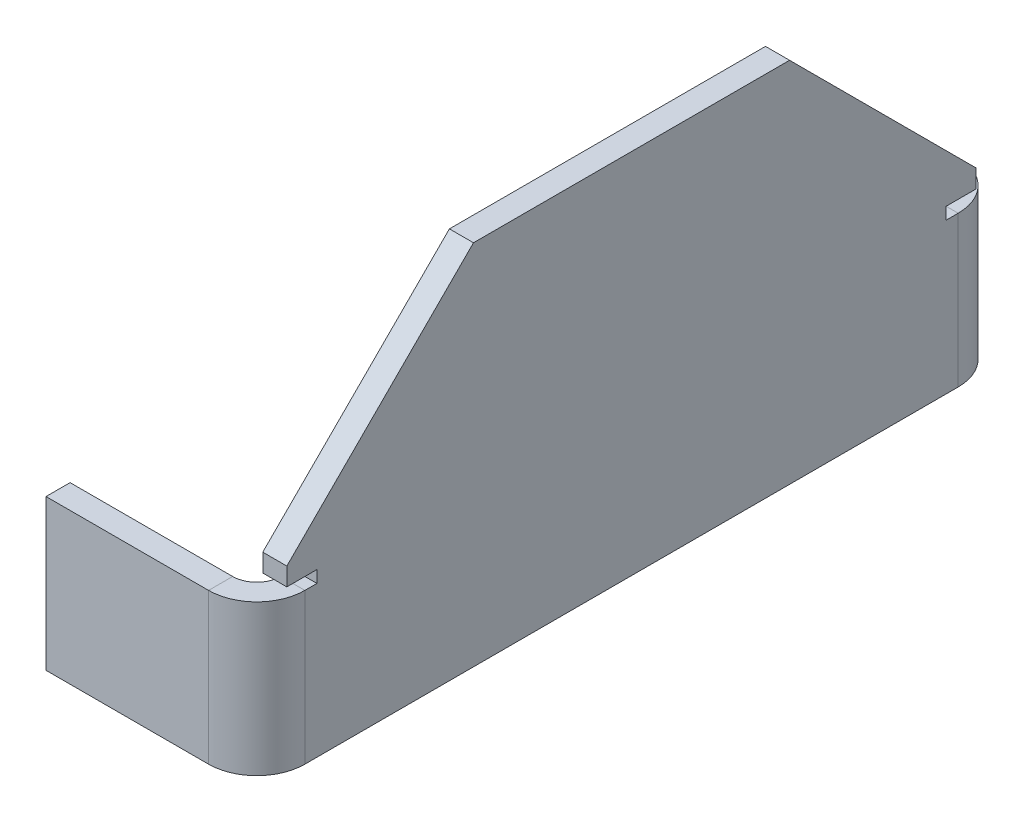
from build123d import *

# Parameters (mm, degrees)
SM_BASE_FLANGE_1_DEPTH              = 8
SM_EDGE_FLANGE_1_STRIP_W            = 48
SM_EDGE_FLANGE_1_STRIP_H            = 8
SM_EDGE_FLANGE_1_STRIP_CUT_DEPTH    = 50
SM_EDGE_FLANGE_1_RELIEF_W           = 52
SM_EDGE_FLANGE_1_RELIEF_H           = 4
SM_EDGE_FLANGE_1_RELIEF_CUT_DEPTH   = 8
SM_EDGE_FLANGE_1_STRIP_2_W          = 48
SM_EDGE_FLANGE_1_STRIP_2_H          = 8
SM_EDGE_FLANGE_1_STRIP_CUT_2_DEPTH  = 50
SM_EDGE_FLANGE_1_RELIEF_2_W         = 52
SM_EDGE_FLANGE_1_RELIEF_2_H         = 4
SM_EDGE_FLANGE_1_RELIEF_CUT_2_DEPTH = 8
SM_EDGE_FLANGE_1_DEPTH              = 50
SM_EDGE_FLANGE_1_BEND_DEPTH         = 50


# Sheet-metal steps are written as plain solids
with BuildPart() as part:
    # Sketch 1 → 基体-法兰1 (new body)
    with BuildSketch(Plane(origin=(0, 0, 0), x_dir=(0, 0, -1), z_dir=(1, 0, 0))):
        Polygon((-52.5, 122), (52.5, 122), (114.5, 60), (114.5, 50), (124.5, 50), (124.5, 0), (-124.5, 0), (-124.5, 50), (-114.5, 50), (-114.5, 60), align=None)
    extrude(amount=-SM_BASE_FLANGE_1_DEPTH)

    # 边线-法兰1 strip (across the edge) → 边线-法兰1 strip cut (cut)
    with BuildSketch(Plane(origin=(-8, 0, 124.5), x_dir=(0, 0, -1), z_dir=(0, 1, 0))):
        with Locations((-8, -4)):
            Rectangle(SM_EDGE_FLANGE_1_STRIP_W, SM_EDGE_FLANGE_1_STRIP_H)
    extrude(amount=SM_EDGE_FLANGE_1_STRIP_CUT_DEPTH, mode=Mode.SUBTRACT)

    # 边线-法兰1 relief (on the sheet) → 边线-法兰1 relief cut (cut)
    with BuildSketch(Plane(origin=(-8, 0, 108.5), x_dir=(0, 0, -1), z_dir=(-1, 0, 0))):
        with Locations((-22, -52)):
            Rectangle(SM_EDGE_FLANGE_1_RELIEF_W, SM_EDGE_FLANGE_1_RELIEF_H)
    extrude(amount=-SM_EDGE_FLANGE_1_RELIEF_CUT_DEPTH, mode=Mode.SUBTRACT)

    # 边线-法兰1 strip 2 (across the edge) → 边线-法兰1 strip cut 2 (cut)
    with BuildSketch(Plane(origin=(-8, 50, -124.5), x_dir=(0, 0, 1), z_dir=(0, -1, 0))):
        with Locations((-8, -4)):
            Rectangle(SM_EDGE_FLANGE_1_STRIP_2_W, SM_EDGE_FLANGE_1_STRIP_2_H)
    extrude(amount=SM_EDGE_FLANGE_1_STRIP_CUT_2_DEPTH, mode=Mode.SUBTRACT)

    # 边线-法兰1 relief 2 (on the sheet) → 边线-法兰1 relief cut 2 (cut)
    with BuildSketch(Plane(origin=(-8, 50, -108.5), x_dir=(0, 0, 1), z_dir=(-1, 0, 0))):
        with Locations((-22, 2)):
            Rectangle(SM_EDGE_FLANGE_1_RELIEF_2_W, SM_EDGE_FLANGE_1_RELIEF_2_H)
    extrude(amount=-SM_EDGE_FLANGE_1_RELIEF_CUT_2_DEPTH, mode=Mode.SUBTRACT)

    # 边线-法兰1 section (across the edge) → 边线-法兰1 (add)
    with BuildSketch(Plane(origin=(-8, 0, 124.5), x_dir=(0, 0, -1), z_dir=(0, 1, 0))):
        with BuildLine():
            Line((0, 8), (0, 62))
            Line((0, 62), (8, 62))
            Line((8, 62), (8, 8))
            ThreePointArc((8, 8), (10.343145751, 2.343145751), (16, 0))
            Line((16, 0), (16, -8))
            ThreePointArc((16, -8), (4.686291501, -3.313708499), (0, 8))
        make_face()
    extrude(amount=SM_EDGE_FLANGE_1_DEPTH)

    # 边线-法兰1 section 2 (across the edge) → 边线-法兰1 bend (add)
    with BuildSketch(Plane(origin=(-8, 50, -124.5), x_dir=(0, 0, 1), z_dir=(0, -1, 0))):
        with BuildLine():
            Line((0, 8), (0, 62))
            Line((0, 62), (8, 62))
            Line((8, 62), (8, 8))
            ThreePointArc((8, 8), (10.343145751, 2.343145751), (16, 0))
            Line((16, 0), (16, -8))
            ThreePointArc((16, -8), (4.686291501, -3.313708499), (0, 8))
        make_face()
    extrude(amount=SM_EDGE_FLANGE_1_BEND_DEPTH)


solid = part.part
